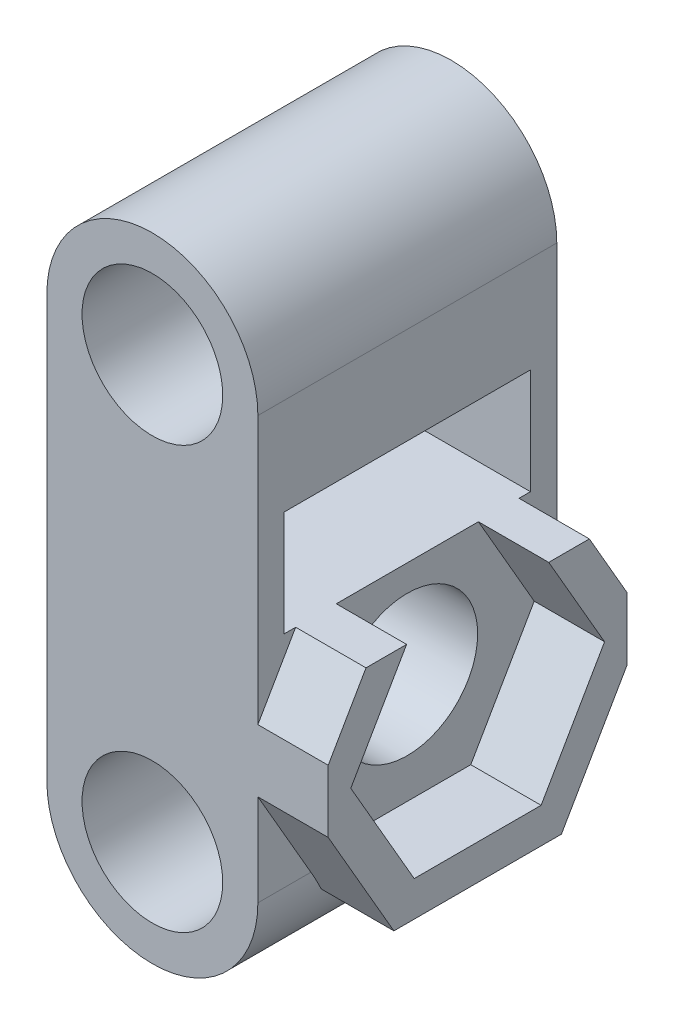
from build123d import *

# Parameters (mm, degrees)
SKETCH1_R                = 2
BOSS_EXTRUDE1_DEPTH      = 8.5
SKETCH2_R                = 2
CUT_EXTRUDE1_DEPTH       = 19.255136264
BOSS_EXTRUDE2_DEPTH      = 2
BOSS_EXTRUDE2_DEPTH_BACK = 0.5
SKETCH4_W                = 7
SKETCH4_H                = 3
CUT_EXTRUDE2_DEPTH       = 20.24153548
SKETCH5_OUTSIDE_W        = 15.902
SKETCH5_OUTSIDE_H        = 24.376
SKETCH5_OUTSIDE_W_2      = 8.5
SKETCH5_OUTSIDE_H_2      = 18
CUT_EXTRUDE3_DEPTH       = 20.24153548


with BuildPart() as part:
    # Sketch1 → Boss-Extrude1 (new body)
    with BuildSketch(Plane.XY):
        with BuildLine():
            Line((-3, 0), (-3, -12))
            ThreePointArc((-3, -12), (0, -15), (3, -12))
            Line((3, -12), (3, 0))
            ThreePointArc((3, 0), (0, 3), (-3, 0))
        make_face()
        Circle(SKETCH1_R, mode=Mode.SUBTRACT)
        with Locations((0, -12)):
            Circle(SKETCH1_R, mode=Mode.SUBTRACT)
    extrude(amount=BOSS_EXTRUDE1_DEPTH)

    # Sketch2 → Cut-Extrude1 (cut, through all)
    with BuildSketch(Plane(origin=(3, 0, 0), x_dir=(0, 0, -1), z_dir=(1, 0, 0))):
        with Locations((-4.25, -8.5)):
            Circle(SKETCH2_R)
    extrude(amount=-CUT_EXTRUDE1_DEPTH, mode=Mode.SUBTRACT)

    # Sketch3 → Boss-Extrude2 (add, two sides: drawn at the far end of the back side and taken through both)
    with BuildSketch(Plane(origin=(3, 0, 0), x_dir=(0, 0, -1), z_dir=(1, 0, 0)).offset(-BOSS_EXTRUDE2_DEPTH_BACK)):
        Polygon((-1.86843014, -4.375), (-6.63156986, -4.375), (-9.013139721, -8.5), (-6.63156986, -12.625), (-1.86843014, -12.625), (0.513139721, -8.5), align=None)
        Polygon((-0.641560818, -8.5), (-2.445780409, -5.375), (-6.054219591, -5.375), (-7.858439182, -8.5), (-6.054219591, -11.625), (-2.445780409, -11.625), align=None, mode=Mode.SUBTRACT)
    extrude(amount=BOSS_EXTRUDE2_DEPTH + BOSS_EXTRUDE2_DEPTH_BACK)

    # Sketch4 → Cut-Extrude2 (cut, through all)
    with BuildSketch(Plane.ZY.offset(3)):
        with Locations((4.25, -4.25)):
            Rectangle(SKETCH4_W, SKETCH4_H)
    extrude(amount=-CUT_EXTRUDE2_DEPTH, mode=Mode.SUBTRACT)

    # Sketch5 outside → Cut-Extrude3 (cut, through all)
    with BuildSketch(Plane.ZY.offset(3)):
        with Locations((4.25, -6)):
            Rectangle(SKETCH5_OUTSIDE_W, SKETCH5_OUTSIDE_H)
        with Locations((4.25, -6)):
            Rectangle(SKETCH5_OUTSIDE_W_2, SKETCH5_OUTSIDE_H_2, mode=Mode.SUBTRACT)
    extrude(amount=-CUT_EXTRUDE3_DEPTH, mode=Mode.SUBTRACT)


solid = part.part
